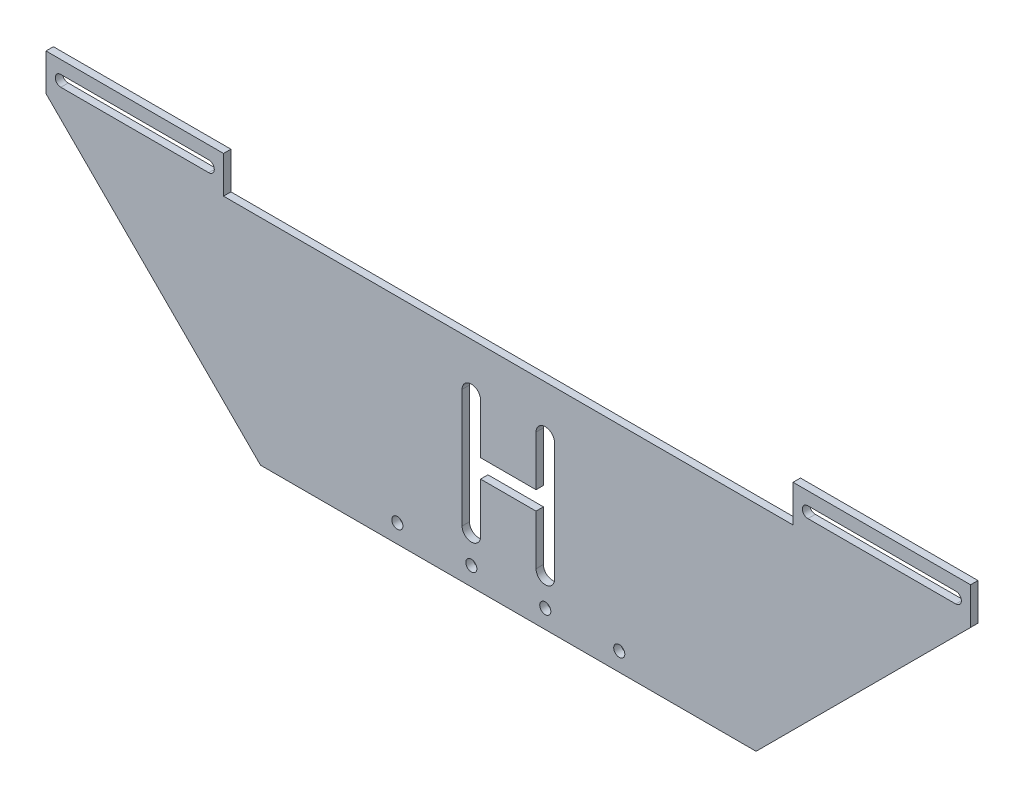
from build123d import *

# Parameters (mm, degrees)
SKETCH_1_R          = 1.5
EXTRUDE_1_DEPTH     = 2
SKETCH_8_W          = 250
SKETCH_8_H          = 20
CUT_EXTRUDE_7_DEPTH = 10
CUT_EXTRUDE_8_DEPTH = 10
CUT_EXTRUDE_9_DEPTH = 10


with BuildPart() as part:
    # 草图1 → 凸台-拉伸1 (new body)
    with BuildSketch(Plane.XY):
        Polygon((-77, 0), (-77, 30), (-125, 30), (-125, 0), (-67, -58), (67, -58), (125, 0), (125, 30), (77, 30), (77, 0), align=None)
        with Locations((-30, -53)):
            Circle(SKETCH_1_R, mode=Mode.SUBTRACT)
        with Locations((-10, -53)):
            Circle(SKETCH_1_R, mode=Mode.SUBTRACT)
        with Locations((10, -53)):
            Circle(SKETCH_1_R, mode=Mode.SUBTRACT)
        with Locations((30, -53)):
            Circle(SKETCH_1_R, mode=Mode.SUBTRACT)
        with Locations((-121, 5)):
            Circle(SKETCH_1_R, mode=Mode.SUBTRACT)
        with Locations((-81, 5)):
            Circle(SKETCH_1_R, mode=Mode.SUBTRACT)
        with Locations((-121, 25)):
            Circle(SKETCH_1_R, mode=Mode.SUBTRACT)
        with Locations((-81, 25)):
            Circle(SKETCH_1_R, mode=Mode.SUBTRACT)
        with Locations((81, 5)):
            Circle(SKETCH_1_R, mode=Mode.SUBTRACT)
        with Locations((121, 5)):
            Circle(SKETCH_1_R, mode=Mode.SUBTRACT)
        with Locations((81, 25)):
            Circle(SKETCH_1_R, mode=Mode.SUBTRACT)
        with Locations((121, 25)):
            Circle(SKETCH_1_R, mode=Mode.SUBTRACT)
    extrude(amount=EXTRUDE_1_DEPTH)

    # 草图8 → 切除-拉伸7 (cut)
    with BuildSketch(Plane.XY.offset(2)):
        with Locations((0, 20)):
            Rectangle(SKETCH_8_W, SKETCH_8_H)
    extrude(amount=-CUT_EXTRUDE_7_DEPTH, mode=Mode.SUBTRACT)

    # 草图9 → 切除-拉伸8 (cut)
    with BuildSketch(Plane(origin=(0, 0, 0), x_dir=(-1, 0, 0), z_dir=(0, 0, -1))):
        with BuildLine():
            ThreePointArc((-121, 6.5), (-119.5, 5), (-121, 3.5))
            Line((-121, 3.5), (-81, 3.5))
            ThreePointArc((-81, 3.5), (-82.5, 5), (-81, 6.5))
            Line((-81, 6.5), (-121, 6.5))
        make_face()
        with BuildLine():
            ThreePointArc((81, 6.5), (82.5, 5), (81, 3.5))
            Line((81, 3.5), (121, 3.5))
            ThreePointArc((121, 3.5), (119.5, 5), (121, 6.5))
            Line((121, 6.5), (81, 6.5))
        make_face()
    extrude(amount=-CUT_EXTRUDE_8_DEPTH, mode=Mode.SUBTRACT)

    # 草图10 → 切除-拉伸9 (cut)
    with BuildSketch(Plane(origin=(0, 0, 0), x_dir=(-1, 0, 0), z_dir=(0, 0, -1))):
        with BuildLine():
            Line((7.5, -26.5), (-7.5, -26.5))
            Line((-7.5, -26.5), (-7.5, -13))
            ThreePointArc((-7.5, -13), (-10, -10.5), (-12.5, -13))
            Line((-12.5, -13), (-12.5, -45))
            ThreePointArc((-12.5, -45), (-10, -47.5), (-7.5, -45))
            Line((-7.5, -45), (-7.5, -31.5))
            Line((-7.5, -31.5), (7.5, -31.5))
            Line((7.5, -31.5), (7.5, -45))
            ThreePointArc((7.5, -45), (10, -47.5), (12.5, -45))
            Line((12.5, -45), (12.5, -13))
            ThreePointArc((12.5, -13), (10, -10.5), (7.5, -13))
            Line((7.5, -13), (7.5, -26.5))
        make_face()
    extrude(amount=-CUT_EXTRUDE_9_DEPTH, mode=Mode.SUBTRACT)


solid = part.part
